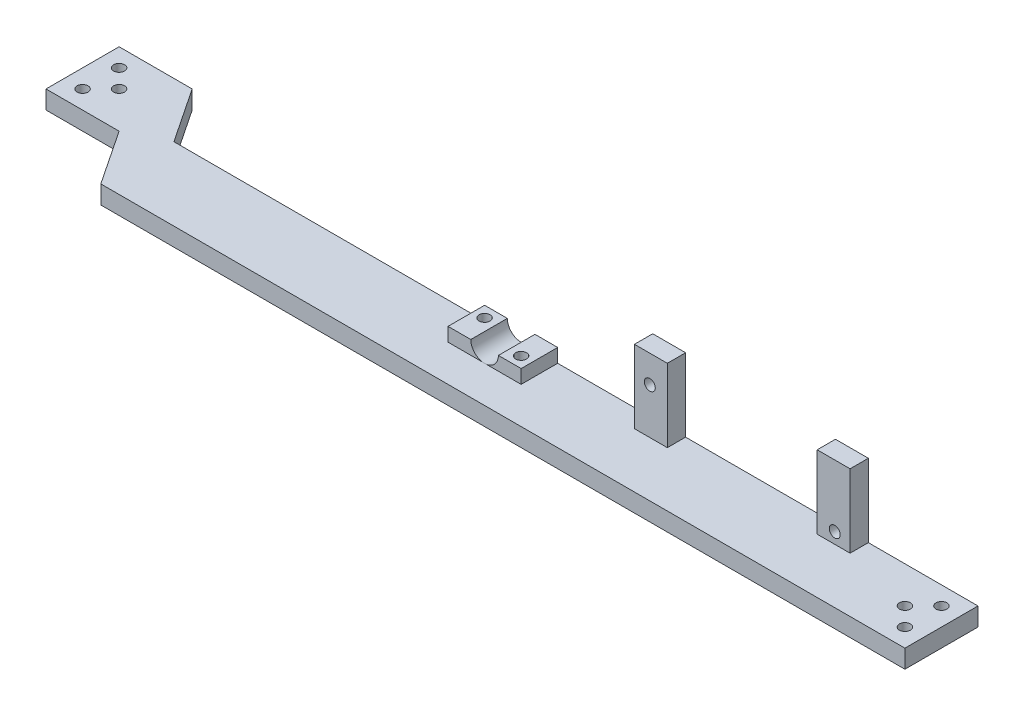
from build123d import *

# Parameters (mm, degrees)
BOSS_EXTRUDE1_DEPTH = 5
SKETCH2_W           = 20
SKETCH2_H           = 10
BOSS_EXTRUDE2_DEPTH = 3.75
SKETCH3_R           = 3.775
CUT_EXTRUDE1_DEPTH  = 10
SKETCH7_R           = 1.5
CUT_EXTRUDE3_DEPTH  = 5
SKETCH4_R           = 1.5
CUT_EXTRUDE2_DEPTH  = 4
SKETCH8_W           = 9
SKETCH8_H           = 5
BOSS_EXTRUDE3_DEPTH = 20
SKETCH9_R           = 1.5
CUT_EXTRUDE4_DEPTH  = 5


with BuildPart() as part:
    # Sketch1 → Boss-Extrude1 (new body)
    with BuildSketch(Plane(origin=(0, 0, 0), x_dir=(1, 0, 0), z_dir=(0, 1, 0))):
        Polygon((-26.305830051, -6.620550836), (193.694169949, -6.620550836), (193.694169949, 13.379449164), (-26.305830051, 13.379449164), (-36.305830051, 28.379449164), (-56.305830051, 28.379449164), (-56.305830051, 8.379449164), (-36.305830051, 8.379449164), align=None)
    extrude(amount=BOSS_EXTRUDE1_DEPTH)

    # Sketch2 → Boss-Extrude2 (add)
    with BuildSketch(Plane(origin=(0, 5, 0), x_dir=(1, 0, 0), z_dir=(0, 1, 0))):
        with Locations((68.694169949, 8.379449164)):
            Rectangle(SKETCH2_W, SKETCH2_H)
    extrude(amount=BOSS_EXTRUDE2_DEPTH)

    # Sketch3 → Cut-Extrude1 (cut)
    with BuildSketch(Plane.XY.offset(-3.379449164)):
        with Locations((68.694169949, 8.75)):
            Circle(SKETCH3_R)
    extrude(amount=-CUT_EXTRUDE1_DEPTH, mode=Mode.SUBTRACT)

    # Sketch7 → Cut-Extrude3 (cut)
    with BuildSketch(Plane(origin=(0, 5, 0), x_dir=(1, 0, 0), z_dir=(0, 1, 0))):
        with Locations((-51.305830051, 23.379449164)):
            Circle(SKETCH7_R)
        with Locations((-51.305830051, 13.379449164)):
            Circle(SKETCH7_R)
        with Locations((188.694169949, -1.620550836)):
            Circle(SKETCH7_R)
        with Locations((188.694169949, 8.379449164)):
            Circle(SKETCH7_R)
        with Locations((183.694169949, 3.379449164)):
            Circle(SKETCH7_R)
        with Locations((-46.305830051, 18.379449164)):
            Circle(SKETCH7_R)
    extrude(amount=-CUT_EXTRUDE3_DEPTH, mode=Mode.SUBTRACT)

    # Sketch4 → Cut-Extrude2 (cut)
    with BuildSketch(Plane(origin=(0, 8.75, 0), x_dir=(1, 0, 0), z_dir=(0, 1, 0))):
        with Locations((75.694169949, 6.379449164)):
            Circle(SKETCH4_R)
        with Locations((61.694169949, 10.379449164)):
            Circle(SKETCH4_R)
    extrude(amount=-CUT_EXTRUDE2_DEPTH, mode=Mode.SUBTRACT)

    # Sketch8 → Boss-Extrude3 (add)
    with BuildSketch(Plane(origin=(0, 5, 0), x_dir=(1, 0, 0), z_dir=(0, 1, 0))):
        with Locations((109.194169949, 10.879449164)):
            Rectangle(SKETCH8_W, SKETCH8_H)
        with Locations((159.194169949, 10.879449164)):
            Rectangle(SKETCH8_W, SKETCH8_H)
    extrude(amount=BOSS_EXTRUDE3_DEPTH)

    # Sketch9 → Cut-Extrude4 (cut)
    with BuildSketch(Plane.XY.offset(-8.379449164)):
        with Locations((108.894169949, 17.5)):
            Circle(SKETCH9_R)
        with Locations((159.494169949, 8)):
            Circle(SKETCH9_R)
    extrude(amount=-CUT_EXTRUDE4_DEPTH, mode=Mode.SUBTRACT)


solid = part.part
